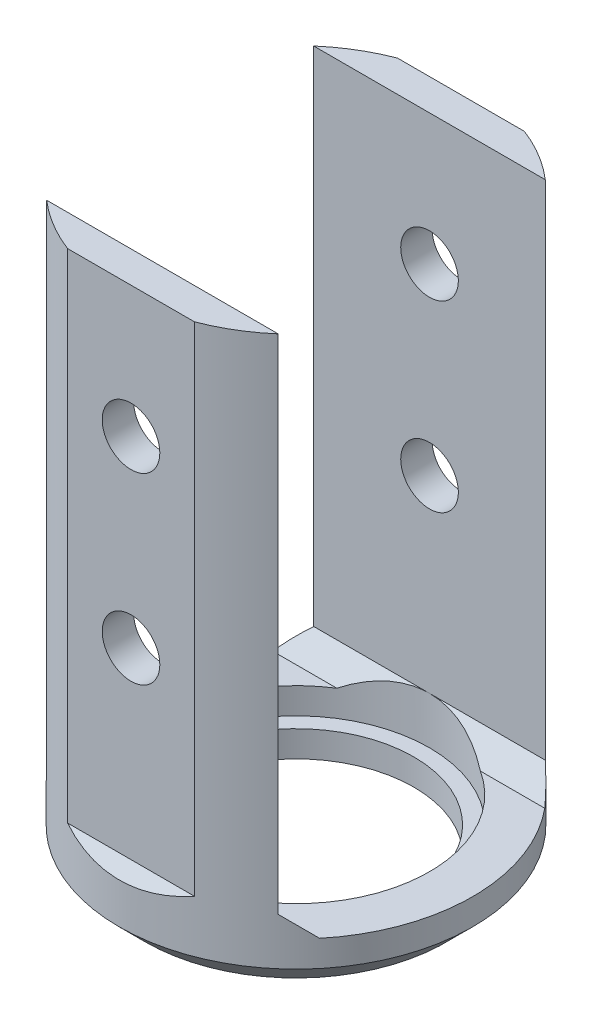
from build123d import *

# Parameters (mm, degrees)
SKETCH_1_R          = 6.75
SKETCH_1_R_2        = 4.5
EXTRUDE_1_DEPTH     = 2
SKETCH_2_R          = 5.1000000000000005
CUT_EXTRUDE_1_DEPTH = 1
EXTRUDE_2_DEPTH     = 20
SKETCH_4_R          = 1.1
CUT_EXTRUDE_2_DEPTH = 20
CHAMFER_1_SIZE      = 1
CHAMFER_2_SIZE      = 1
CHAMFER_3_SIZE      = 0.8


with BuildPart() as part:
    # 草图1 → 凸台-拉伸1 (new body)
    with BuildSketch(Plane(origin=(0, 0, 0), x_dir=(1, 0, 0), z_dir=(0, 1, 0))):
        with Locations(Location((0, 0, 0), (0, 0, 270))):
            Circle(SKETCH_1_R)
        with Locations(Location((0, 0, 0), (0, 0, 270))):
            Circle(SKETCH_1_R_2, mode=Mode.SUBTRACT)
    extrude(amount=EXTRUDE_1_DEPTH)

    # 草图2 → 切除-拉伸1 (cut)
    with BuildSketch(Plane(origin=(0, 2, 0), x_dir=(1, 0, 0), z_dir=(0, 1, 0))):
        with Locations(Location((0, 0, 0), (0, 0, 270))):
            Circle(SKETCH_2_R)
    extrude(amount=-CUT_EXTRUDE_1_DEPTH, mode=Mode.SUBTRACT)

    # 草图3 → 凸台-拉伸2 (add)
    with BuildSketch(Plane(origin=(0, 2, 0), x_dir=(1, 0, 0), z_dir=(0, 1, 0))):
        with BuildLine():
            ThreePointArc((-2.4233241632105296, 6.299999999999999), (-3.4747665686142524, 5.786924683598426), (-4.421820891895102, 5.1))
            Line((-4.421820891895103, 5.1), (4.421820891895103, 5.1))
            ThreePointArc((4.421820891895103, 5.099999999999999), (3.4747665686142533, 5.786924683598425), (2.4233241632105287, 6.299999999999999))
            Line((2.4233241632105287, 6.299999999999999), (-2.4233241632105287, 6.299999999999999))
        make_face()
        with BuildLine():
            Line((4.421820891895103, -5.1), (-4.421820891895103, -5.1))
            ThreePointArc((-4.421820891895104, -5.099999999999999), (-3.4747665686142537, -5.786924683598424), (-2.4233241632105327, -6.299999999999998))
            Line((-2.4233241632105287, -6.299999999999999), (2.4233241632105287, -6.299999999999999))
            ThreePointArc((2.4233241632105305, -6.299999999999999), (3.4747665686142515, -5.786924683598426), (4.4218208918951, -5.100000000000002))
        make_face()
    extrude(amount=EXTRUDE_2_DEPTH)

    # 草图4 → 切除-拉伸2 (cut)
    with BuildSketch(Plane.XY.offset(6.299999999999999)):
        with Locations((0, 17)):
            Circle(SKETCH_4_R)
        with Locations((0, 10)):
            Circle(SKETCH_4_R)
    extrude(amount=-CUT_EXTRUDE_2_DEPTH, mode=Mode.SUBTRACT)

    # 倒角1
    chamfer_1_edges = [part.edges().sort_by_distance(p)[0] for p in [
        (2.07e-15, 0, -6.75),
    ]]
    chamfer(chamfer_1_edges, length=CHAMFER_1_SIZE)

    # 倒角2
    # the kernel refuses this chamfer: 1 mm, written as the material it adds along each edge
    with BuildSketch(Plane(origin=(-4.99500715117644, 2, 6.299999999999999), x_dir=(0, -0.02749587661058627, 0.9996219169112968), z_dir=(1, 0, 0))) as chamfer_2_piece_1_section:
        Polygon((CHAMFER_2_SIZE * 0.999621916911, -CHAMFER_2_SIZE * 0.0274958766106), (-CHAMFER_2_SIZE * 0.0274958766106, -CHAMFER_2_SIZE * 0.999621916911), (0, 0), align=None)
    chamfer_2_piece_1 = extrude(amount=9.99001430235288, mode=Mode.PRIVATE)
    chamfer_2_piece_1 = chamfer_2_piece_1 & Plane(origin=(0, 2.4270240962086875, 0), x_dir=(-1.8e-16, 0, 1), z_dir=(0, -1, 0)) * Cylinder(6.75, 24, mode=Mode.PRIVATE)
    add(chamfer_2_piece_1)
    with BuildSketch(Plane(origin=(4.99500715117644, 2, -6.299999999999999), x_dir=(0, -0.02749587661058627, -0.9996219169112968), z_dir=(-1, 0, 0))) as chamfer_2_piece_2_section:
        Polygon((CHAMFER_2_SIZE * 0.999621916911, -CHAMFER_2_SIZE * 0.0274958766106), (-CHAMFER_2_SIZE * 0.0274958766106, -CHAMFER_2_SIZE * 0.999621916911), (0, 0), align=None)
    chamfer_2_piece_2 = extrude(amount=9.99001430235288, mode=Mode.PRIVATE)
    chamfer_2_piece_2 = chamfer_2_piece_2 & Plane(origin=(0, 2.4270241038722706, 0), x_dir=(-1.8e-16, 0, 1), z_dir=(0, -1, 0)) * Cylinder(6.75, 24, mode=Mode.PRIVATE)
    add(chamfer_2_piece_2)

    # 倒角3
    # the kernel refuses this chamfer: 0.8 mm, written as the material it adds along each edge
    with BuildSketch(Plane(origin=(6.22e-15, 2, -5.1), x_dir=(0, 0.9996219169112968, -0.027495876610586285), z_dir=(1, 0, 0))) as chamfer_3_piece_1_section:
        Polygon((CHAMFER_3_SIZE * 0.999621916911, CHAMFER_3_SIZE * 0.0274958766106), (-CHAMFER_3_SIZE * 0.0274958766106, CHAMFER_3_SIZE * 0.999621916911), (0, 0), align=None)
    chamfer_3_piece_1 = extrude(amount=6.479167282267824, mode=Mode.PRIVATE)
    chamfer_3_piece_1 = chamfer_3_piece_1 & Plane(origin=(0, 2.278466401916116, 0), x_dir=(-1.8e-16, 0, 1), z_dir=(0, -1, 0)) * Cylinder(6.75, 17, mode=Mode.PRIVATE)
    chamfer_3_piece_1 = chamfer_3_piece_1 - Plane(origin=(0, 2.278466401916116, 0), x_dir=(-1.8e-16, 0, 1), z_dir=(0, 1, 0)) * Cylinder(5.1000000000000005, 17, mode=Mode.PRIVATE)
    add(chamfer_3_piece_1)
    with BuildSketch(Plane(origin=(-6.479167282267831, 2, -5.1), x_dir=(0, 0.9996219169112968, -0.027495876610586285), z_dir=(1, 0, 0))) as chamfer_3_piece_2_section:
        Polygon((CHAMFER_3_SIZE * 0.999621916911, CHAMFER_3_SIZE * 0.0274958766106), (-CHAMFER_3_SIZE * 0.0274958766106, CHAMFER_3_SIZE * 0.999621916911), (0, 0), align=None)
    chamfer_3_piece_2 = extrude(amount=6.479167282267837, mode=Mode.PRIVATE)
    chamfer_3_piece_2 = chamfer_3_piece_2 & Plane(origin=(0, 2.27846640235757, 0), x_dir=(-1.8e-16, 0, 1), z_dir=(0, -1, 0)) * Cylinder(6.75, 17, mode=Mode.PRIVATE)
    chamfer_3_piece_2 = chamfer_3_piece_2 - Plane(origin=(0, 2.27846640235757, 0), x_dir=(-1.8e-16, 0, 1), z_dir=(0, 1, 0)) * Cylinder(5.1000000000000005, 17, mode=Mode.PRIVATE)
    add(chamfer_3_piece_2)
    with BuildSketch(Plane(origin=(-8.9e-16, 2, 5.1), x_dir=(0, -0.027495876610586285, -0.9996219169112968), z_dir=(-1, 0, 0))) as chamfer_3_piece_3_section:
        Polygon((CHAMFER_3_SIZE * 0.999621916911, -CHAMFER_3_SIZE * 0.0274958766106), (-CHAMFER_3_SIZE * 0.0274958766106, -CHAMFER_3_SIZE * 0.999621916911), (0, 0), align=None)
    chamfer_3_piece_3 = extrude(amount=6.479167282267829, mode=Mode.PRIVATE)
    chamfer_3_piece_3 = chamfer_3_piece_3 & Plane(origin=(0, 2.2784664022483097, 0), x_dir=(-1.8e-16, 0, 1), z_dir=(0, -1, 0)) * Cylinder(6.75, 17, mode=Mode.PRIVATE)
    chamfer_3_piece_3 = chamfer_3_piece_3 - Plane(origin=(0, 2.2784664022483097, 0), x_dir=(-1.8e-16, 0, 1), z_dir=(0, 1, 0)) * Cylinder(5.1000000000000005, 17, mode=Mode.PRIVATE)
    add(chamfer_3_piece_3)
    with BuildSketch(Plane(origin=(6.479167282267831, 2, 5.1), x_dir=(0, -0.027495876610586285, -0.9996219169112968), z_dir=(-1, 0, 0))) as chamfer_3_piece_4_section:
        Polygon((CHAMFER_3_SIZE * 0.999621916911, -CHAMFER_3_SIZE * 0.0274958766106), (-CHAMFER_3_SIZE * 0.0274958766106, -CHAMFER_3_SIZE * 0.999621916911), (0, 0), align=None)
    chamfer_3_piece_4 = extrude(amount=6.479167282267832, mode=Mode.PRIVATE)
    chamfer_3_piece_4 = chamfer_3_piece_4 & Plane(origin=(0, 2.278466402305348, 0), x_dir=(-1.8e-16, 0, 1), z_dir=(0, -1, 0)) * Cylinder(6.75, 17, mode=Mode.PRIVATE)
    chamfer_3_piece_4 = chamfer_3_piece_4 - Plane(origin=(0, 2.278466402305348, 0), x_dir=(-1.8e-16, 0, 1), z_dir=(0, 1, 0)) * Cylinder(5.1000000000000005, 17, mode=Mode.PRIVATE)
    add(chamfer_3_piece_4)


solid = part.part
